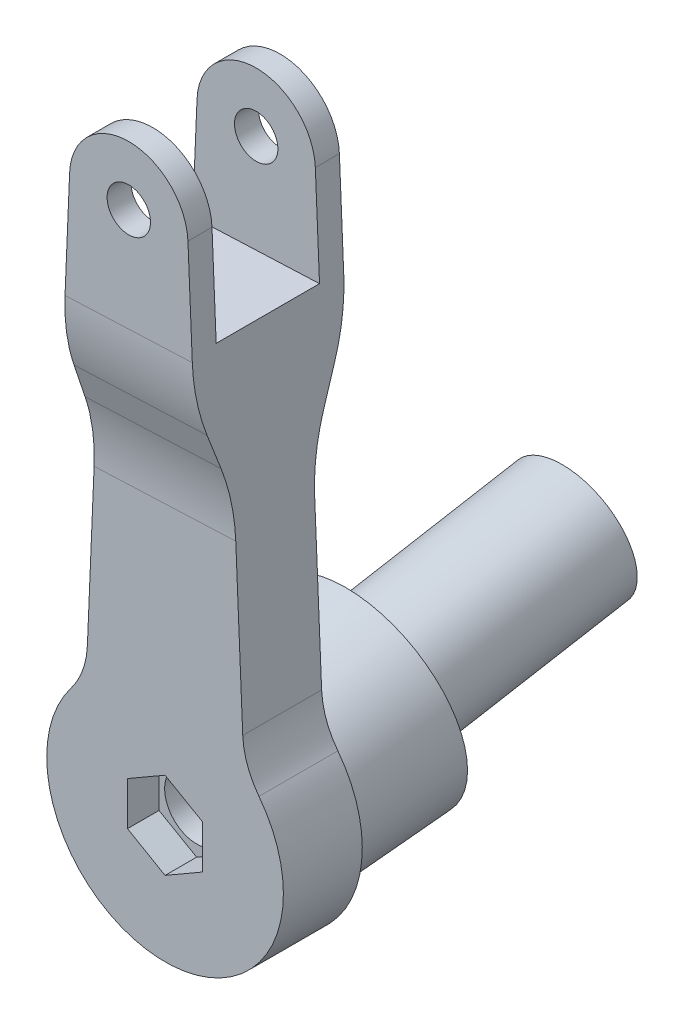
from build123d import *

# Parameters (mm, degrees)
SKETCH1_R               = 2.75
BOSS_EXTRUDE1_DEPTH     = 19.2
CUT_EXTRUDE4_DEPTH      = 84.275329734
CUT_EXTRUDE4_DEPTH_BACK = 84.275329734
SKETCH13_OUTSIDE_W      = 41
SKETCH13_OUTSIDE_H      = 115.36
CUT_EXTRUDE2_DEPTH      = 4
SKETCH4_R               = 4.05
CUT_EXTRUDE3_DEPTH      = 20
FILLET4_R               = 10
BOSS_EXTRUDE2_REACH     = 83.7
SKETCH9_R               = 13
SKETCH10_R              = 8
BOSS_EXTRUDE3_DEPTH     = 27
DRAFT1_ANGLE            = -3
FILLET5_R               = 25
SKETCH14_R              = 2
CUT_EXTRUDE5_DEPTH      = 4


with BuildPart() as part:
    # Sketch1 → Boss-Extrude1 (new body)
    with BuildSketch(Plane.XY):
        with BuildLine():
            Line((-7.5, 70.183778092), (-10, 11.180339887))
            ThreePointArc((-10, 11.180339887), (0, -15), (10, 11.180339887))
            Line((10, 11.180339887), (7.5, 70.183778092))
            ThreePointArc((7.5, 70.183778092), (0, 77.372729176), (-7.5, 70.183778092))
        make_face()
        with Locations((0, 69.866)):
            Circle(SKETCH1_R, mode=Mode.SUBTRACT)
    extrude(amount=BOSS_EXTRUDE1_DEPTH)

    # Sketch13 outside → Cut-Extrude4 (cut, two sides: drawn at the far end of the back side and taken through both)
    with BuildSketch(Plane(origin=(10.454946348, 0.442980387, 0), x_dir=(0, 0, -1), z_dir=(0.9991035808766652, 0.042332430587259585, 0)).offset(-CUT_EXTRUDE4_DEPTH_BACK)):
        with Locations((-9.6, 31.158)):
            Rectangle(SKETCH13_OUTSIDE_W, SKETCH13_OUTSIDE_H)
        Polygon((-16.15, 77.310099957), (-16.15, 57.310099957), (-3.05, 57.310099957), (-3.05, 77.310099957), (0, 77.310099957), (0, 52.310099957), (-4.6, 39.671703828), (-4.6, -15), (-14.6, -15), (-14.6, 39.671703828), (-19.2, 52.310099957), (-19.2, 77.310099957), align=None, mode=Mode.SUBTRACT)
    extrude(amount=CUT_EXTRUDE4_DEPTH + CUT_EXTRUDE4_DEPTH_BACK, mode=Mode.SUBTRACT)

    # Sketch3 → Cut-Extrude2 (cut)
    with BuildSketch(Plane.XY.offset(14.6)):
        Polygon((0, 5.500000322), (-4.76314, 2.750000161), (-4.76314, -2.750000161), (0, -5.500000322), (4.76314, -2.750000161), (4.76314, 2.750000161), align=None)
    extrude(amount=-CUT_EXTRUDE2_DEPTH, mode=Mode.SUBTRACT)

    # Sketch4 → Cut-Extrude3 (cut)
    with BuildSketch(Plane.XY.offset(10.6)):
        Circle(SKETCH4_R)
    extrude(amount=-CUT_EXTRUDE3_DEPTH, mode=Mode.SUBTRACT)

    # Fillet4
    fillet4_edges = [part.edges().sort_by_distance(p)[0] for p in [
        (-10, 11.180339887, 9.6),
        (10, 11.180339887, 9.6),
    ]]
    fillet(fillet4_edges, radius=FILLET4_R)

    # Boss-Extrude2: up to this plane
    boss_extrude2_end = Plane(origin=(-17.286936373, 38.974843589, 4.6), z_dir=(0, 0, -1))
    # Sketch9 → Boss-Extrude2 (add, up to the surface)
    with BuildSketch(Plane(origin=(0, 2.715435503, -10.4), x_dir=(-1, 0, 0), z_dir=(0, 0.17364817766692367, -0.9848077530122092)), mode=Mode.PRIVATE) as boss_extrude2_sk1:
        with Locations((0, -0.868240888)):
            Circle(SKETCH9_R)
    boss_extrude2_tool1 = split(extrude(boss_extrude2_sk1.sketch, amount=-BOSS_EXTRUDE2_REACH, mode=Mode.PRIVATE), bisect_by=boss_extrude2_end, keep=Keep.BOTH, mode=Mode.PRIVATE)
    add(boss_extrude2_tool1.solids().sort_by_distance((0, 1.860385, -10.550768))[0])

    # Sketch10 → Boss-Extrude3 (add)
    with BuildSketch(Plane(origin=(0, 1.860385145, -10.550768448), x_dir=(-1, 0, 0), z_dir=(0, 0.17364817766692367, -0.9848077530122092))):
        Circle(SKETCH10_R)
    extrude(amount=BOSS_EXTRUDE3_DEPTH)

    # Draft1
    draft1_faces = [part.faces().sort_by_distance(p)[0] for p in [
        (13, 0.320865392, -1.819718062),
    ]]
    draft(draft1_faces, Plane(origin=(0, 1.860385145, -10.550768448), x_dir=(0, -0.9848077530122092, -0.17364817766692367), z_dir=(0, 0.17364817766692367, -0.9848077530122092)), DRAFT1_ANGLE)

    # Fillet5
    fillet5_edges = [part.edges().sort_by_distance(p)[0] for p in [
        (-0.014820438, 52.356405855, 0),
        (-0.01578265, 39.706629492, 4.6),
        (-0.01578265, 39.706629492, 14.6),
        (-0.014820438, 52.356405855, 19.2),
    ]]
    fillet(fillet5_edges, radius=FILLET5_R)

    # Sketch14 → Cut-Extrude5 (cut)
    with BuildSketch(Plane(origin=(0, 6.548885942, -37.140577779), x_dir=(-1, 0, 0), z_dir=(0, 0.17364817766692367, -0.9848077530122092))):
        with Locations((-3.464101615, 2)):
            Circle(SKETCH14_R)
        with Locations((3.464101615, 2)):
            Circle(SKETCH14_R)
        with Locations((0, -4)):
            Circle(SKETCH14_R)
    extrude(amount=-CUT_EXTRUDE5_DEPTH, mode=Mode.SUBTRACT)


solid = part.part
